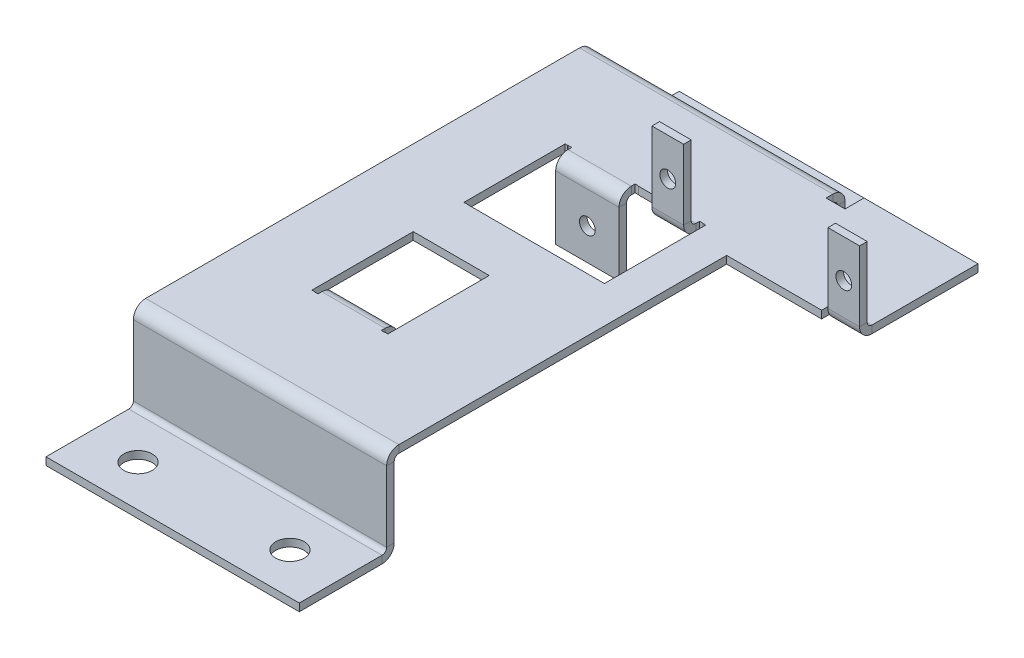
from build123d import *

# Parameters (mm, degrees)
SKETCH_1_W                       = 40
SKETCH_1_H                       = 15
SM_BASE_FLANGE_1_DEPTH           = 1.2
SM_EDGE_FLANGE_1_STRIP_W         = 6.2732
SM_EDGE_FLANGE_1_STRIP_H         = 1.2
SM_EDGE_FLANGE_1_STRIP_CUT_DEPTH = 40
SM_EDGE_FLANGE_1_DEPTH           = 40
SM_EDGE_FLANGE_2_STRIP_W         = 6.2732
SM_EDGE_FLANGE_2_STRIP_H         = 1.2
SM_EDGE_FLANGE_2_STRIP_CUT_DEPTH = 40
SM_EDGE_FLANGE_2_DEPTH           = 40
SM_EDGE_FLANGE_2_FLAT_DEPTH      = 1.2
SM_EDGE_FLANGE_3_STRIP_W         = 6.2732
SM_EDGE_FLANGE_3_STRIP_H         = 1.2
SM_EDGE_FLANGE_3_STRIP_CUT_DEPTH = 40
SM_EDGE_FLANGE_3_DEPTH           = 40
SM_EDGE_FLANGE_4_STRIP_W         = 6.2732
SM_EDGE_FLANGE_4_STRIP_H         = 1.2
SM_EDGE_FLANGE_4_STRIP_CUT_DEPTH = 40
SM_EDGE_FLANGE_4_DEPTH           = 40
CUT_EXTRUDE_1_DEPTH              = 10
SM_START                         = 13
SM_EDGE_FLANGE_5_DEPTH           = 10
SM_START_2                       = 12.4
SM_EDGE_FLANGE_5_2_OUTLINE_W     = 1.2
SM_EDGE_FLANGE_5_2_OUTLINE_H     = 0.0366
SM_EDGE_FLANGE_5_2_DEPTH         = 0.6
SM_START_3                       = 23
SM_EDGE_FLANGE_5_3_OUTLINE_W     = 1.2
SM_EDGE_FLANGE_5_3_OUTLINE_H     = 0.0366
SM_EDGE_FLANGE_5_3_DEPTH         = 0.6
SM_EDGE_FLANGE_5_4_DEPTH         = 10
SKETCH_26_R                      = 1.25
CUT_EXTRUDE_2_DEPTH              = 46
CUT_EXTRUDE_3_REACH              = 120.093
SKETCH_28_W                      = 1
SKETCH_28_H                      = 2.5
SM_START_4                       = 28.2
SM_EDGE_FLANGE_6_DEPTH           = 5
SM_START_5                       = 56
SM_EDGE_FLANGE_6_2_DEPTH         = 5
SM_START_6                       = 27.6
SM_EDGE_FLANGE_6_3_OUTLINE_W     = 1.2
SM_EDGE_FLANGE_6_3_OUTLINE_H     = 0.0366
SM_EDGE_FLANGE_6_3_DEPTH         = 0.6
SM_START_7                       = 33.2
SM_EDGE_FLANGE_6_4_OUTLINE_W     = 1.2
SM_EDGE_FLANGE_6_4_OUTLINE_H     = 0.0366
SM_EDGE_FLANGE_6_4_DEPTH         = 0.6
SM_START_8                       = 55.4
SM_EDGE_FLANGE_6_5_OUTLINE_W     = 1.2
SM_EDGE_FLANGE_6_5_OUTLINE_H     = 0.0366
SM_EDGE_FLANGE_6_5_DEPTH         = 0.6
SM_EDGE_FLANGE_6_6_DEPTH         = 5
SM_EDGE_FLANGE_6_7_DEPTH         = 5
CUT_EXTRUDE_4_REACH              = 96.512
SKETCH_35_R                      = 1.25
CUT_EXTRUDE_5_REACH              = 120.093
SKETCH_36_R                      = 2.25


# Read off the part's stored shape, not the designer's step: Ребро-кромка5, Ребро-кромка6
# Sheet-metal steps are written as plain solids
with BuildPart() as part:
    # Sketch 1 → Базовая кромка1 (new body)
    with BuildSketch(Plane(origin=(0, 0, 0), x_dir=(1, 0, 0), z_dir=(0, 1, 0))):
        with Locations((20, 7.5)):
            Rectangle(SKETCH_1_W, SKETCH_1_H)
    extrude(amount=-SM_BASE_FLANGE_1_DEPTH)

    # Ребро-кромка1 strip (across the edge) → Ребро-кромка1 strip cut (cut)
    with BuildSketch(Plane(origin=(40, 0, -15), x_dir=(0, 0, 1), z_dir=(-1, 0, 0))):
        with Locations((-1.2, -0.6)):
            Rectangle(SM_EDGE_FLANGE_1_STRIP_W, SM_EDGE_FLANGE_1_STRIP_H)
    extrude(amount=SM_EDGE_FLANGE_1_STRIP_CUT_DEPTH, mode=Mode.SUBTRACT)

    # Ребро-кромка1 section (across the edge) → Ребро-кромка1 (add)
    with BuildSketch(Plane(origin=(40, 0, -15), x_dir=(0, 0, 1), z_dir=(-1, 0, 0))):
        with BuildLine():
            Line((0, 0.7366), (0, 13.8))
            Line((0, 13.8), (1.2, 13.8))
            Line((1.2, 13.8), (1.2, 0.7366))
            ThreePointArc((1.2, 0.7366), (1.415745145, 0.215745145), (1.9366, 0))
            Line((1.9366, 0), (1.9366, -1.2))
            ThreePointArc((1.9366, -1.2), (0.567217008, -0.632782992), (0, 0.7366))
        make_face()
    extrude(amount=SM_EDGE_FLANGE_1_DEPTH)

    # Ребро-кромка2 strip (across the edge) → Ребро-кромка2 strip cut (cut)
    with BuildSketch(Plane(origin=(0, 13.8, -15), x_dir=(0, -1, 0), z_dir=(1, 0, 0))):
        with Locations((-1.2, -0.6)):
            Rectangle(SM_EDGE_FLANGE_2_STRIP_W, SM_EDGE_FLANGE_2_STRIP_H)
    extrude(amount=SM_EDGE_FLANGE_2_STRIP_CUT_DEPTH, mode=Mode.SUBTRACT)

    # Ребро-кромка2 bend section (across the edge) → Ребро-кромка2 (add)
    with BuildSketch(Plane(origin=(0, 13.8, -15), x_dir=(0, -1, 0), z_dir=(1, 0, 0))):
        with BuildLine():
            Line((0, 0.7366), (1.2, 0.7366))
            ThreePointArc((1.2, 0.7366), (1.415745145, 0.215745145), (1.9366, 0))
            Line((1.9366, 0), (1.9366, -1.2))
            ThreePointArc((1.9366, -1.2), (0.567217008, -0.632782992), (0, 0.7366))
        make_face()
    extrude(amount=SM_EDGE_FLANGE_2_DEPTH)

    # Ребро-кромка2 profile (on flange) → Ребро-кромка2 flat (add)
    with BuildSketch(Plane(origin=(0, 13.8, -15), x_dir=(1, 0, 0), z_dir=(0, 1, 0))):
        Polygon((43, 71.2), (43, 68.2), (40, 68.2), (40, 71.2), (0, 71.2), (0, 0.7366), (40, 0.7366), (40, 52.5), (61, 52.5), (61, 71.2), align=None)
    extrude(amount=-SM_EDGE_FLANGE_2_FLAT_DEPTH)

    # Ребро-кромка3 strip (across the edge) → Ребро-кромка3 strip cut (cut)
    with BuildSketch(Plane(origin=(0, 12.6, -86.2), x_dir=(0, 0, 1), z_dir=(1, 0, 0))):
        with Locations((-1.2, -0.6)):
            Rectangle(SM_EDGE_FLANGE_3_STRIP_W, SM_EDGE_FLANGE_3_STRIP_H)
    extrude(amount=SM_EDGE_FLANGE_3_STRIP_CUT_DEPTH, mode=Mode.SUBTRACT)

    # Ребро-кромка3 section (across the edge) → Ребро-кромка3 (add)
    with BuildSketch(Plane(origin=(0, 12.6, -86.2), x_dir=(0, 0, 1), z_dir=(1, 0, 0))):
        with BuildLine():
            Line((0, 0.7366), (0, 13.8))
            Line((0, 13.8), (1.2, 13.8))
            Line((1.2, 13.8), (1.2, 0.7366))
            ThreePointArc((1.2, 0.7366), (1.415745145, 0.215745145), (1.9366, 0))
            Line((1.9366, 0), (1.9366, -1.2))
            ThreePointArc((1.9366, -1.2), (0.567217008, -0.632782992), (0, 0.7366))
        make_face()
    extrude(amount=SM_EDGE_FLANGE_3_DEPTH)

    # Ребро-кромка4 strip (across the edge) → Ребро-кромка4 strip cut (cut)
    with BuildSketch(Plane(origin=(40, -1.2, -86.2), x_dir=(0, 1, 0), z_dir=(-1, 0, 0))):
        with Locations((-1.2, -0.6)):
            Rectangle(SM_EDGE_FLANGE_4_STRIP_W, SM_EDGE_FLANGE_4_STRIP_H)
    extrude(amount=SM_EDGE_FLANGE_4_STRIP_CUT_DEPTH, mode=Mode.SUBTRACT)

    # Ребро-кромка4 section (across the edge) → Ребро-кромка4 (add)
    with BuildSketch(Plane(origin=(40, -1.2, -86.2), x_dir=(0, 1, 0), z_dir=(-1, 0, 0))):
        with BuildLine():
            Line((0, 0.7366), (0, 13.8))
            Line((0, 13.8), (1.2, 13.8))
            Line((1.2, 13.8), (1.2, 0.7366))
            ThreePointArc((1.2, 0.7366), (1.415745145, 0.215745145), (1.9366, 0))
            Line((1.9366, 0), (1.9366, -1.2))
            ThreePointArc((1.9366, -1.2), (0.567217008, -0.632782992), (0, 0.7366))
        make_face()
    extrude(amount=SM_EDGE_FLANGE_4_DEPTH)

    # Эскиз19 → Вырез-Вытянуть1 (cut)
    with BuildSketch(Plane(origin=(0, 13.8, 0), x_dir=(1, 0, 0), z_dir=(0, 1, 0))):
        Polygon((13, 32.5), (23, 32.5), (23, 30), (24, 30), (24, 46), (12, 46), (12, 30), (13, 30), align=None)
        Polygon((12, 54), (24, 54), (24, 70), (23, 70), (23, 67.5), (13, 67.5), (13, 70), (12, 70), align=None)
    extrude(amount=-CUT_EXTRUDE_1_DEPTH, mode=Mode.SUBTRACT)

    # Ребро-кромка5 outline → Ребро-кромка5 (cut)
    with BuildSketch(Plane.YZ.offset(SM_START)):
        with BuildLine():
            Line((12.6, -67.5), (12.6, -67.645555612))
            ThreePointArc((12.6, -67.645555612), (13.472269031, -68.358657516), (13.8, -69.4366))
            Line((13.8, -69.4366), (13.8, -67.5))
            Line((13.8, -67.5), (12.6, -67.5))
        make_face()
        with BuildLine():
            Line((12.6, -32.354444388), (12.6, -32.5))
            Line((12.6, -32.5), (13.8, -32.5))
            Line((13.8, -32.5), (13.8, -30.5634))
            ThreePointArc((13.8, -30.5634), (13.472269031, -31.641342484), (12.6, -32.354444388))
        make_face()
    extrude(amount=SM_EDGE_FLANGE_5_DEPTH, mode=Mode.SUBTRACT)

    # Sm Edge Flange 5 2 outline → Sm Edge Flange 5 2 (cut)
    with BuildSketch(Plane.YZ.offset(SM_START_2)):
        with Locations((13.2, -70.0183)):
            Rectangle(SM_EDGE_FLANGE_5_2_OUTLINE_W, SM_EDGE_FLANGE_5_2_OUTLINE_H)
        with Locations((13.2, -29.9817)):
            Rectangle(SM_EDGE_FLANGE_5_2_OUTLINE_W, SM_EDGE_FLANGE_5_2_OUTLINE_H)
    extrude(amount=SM_EDGE_FLANGE_5_2_DEPTH, mode=Mode.SUBTRACT)

    # Sm Edge Flange 5 3 outline → Sm Edge Flange 5 3 (cut)
    with BuildSketch(Plane.YZ.offset(SM_START_3)):
        with Locations((13.2, -70.0183)):
            Rectangle(SM_EDGE_FLANGE_5_3_OUTLINE_W, SM_EDGE_FLANGE_5_3_OUTLINE_H)
        with Locations((13.2, -29.9817)):
            Rectangle(SM_EDGE_FLANGE_5_3_OUTLINE_W, SM_EDGE_FLANGE_5_3_OUTLINE_H)
    extrude(amount=SM_EDGE_FLANGE_5_3_DEPTH, mode=Mode.SUBTRACT)

    # Sm Edge Flange 5 4 outline → Sm Edge Flange 5 4 (add)
    with BuildSketch(Plane.YZ.offset(SM_START)):
        with BuildLine():
            Line((11.8634, -67.5), (1.8, -67.5))
            Line((1.8, -67.5), (1.8, -68.7))
            Line((1.8, -68.7), (11.8634, -68.7))
            ThreePointArc((11.8634, -68.7), (12.384254855, -68.915745145), (12.6, -69.4366))
            Line((12.6, -69.4366), (12.6, -67.645555612))
            ThreePointArc((12.6, -67.645555612), (12.238821762, -67.536737358), (11.8634, -67.5))
        make_face()
        with BuildLine():
            ThreePointArc((11.8634, -32.5), (12.238821762, -32.463262642), (12.6, -32.354444388))
            Line((12.6, -32.354444388), (12.6, -30.5634))
            ThreePointArc((12.6, -30.5634), (12.384254855, -31.084254855), (11.8634, -31.3))
            Line((11.8634, -31.3), (1.8, -31.3))
            Line((1.8, -31.3), (1.8, -32.5))
            Line((1.8, -32.5), (11.8634, -32.5))
        make_face()
    extrude(amount=SM_EDGE_FLANGE_5_4_DEPTH)

    # Эскиз26 → Вырез-Вытянуть2 (cut)
    with BuildSketch(Plane.XY.offset(-31.3)):
        with Locations((18, 6.8317)):
            Circle(SKETCH_26_R)
    extrude(amount=-CUT_EXTRUDE_2_DEPTH, mode=Mode.SUBTRACT)

    # Эскиз28 → Вырез-Вытянуть3 (cut, up to next)
    with BuildSketch(Plane(origin=(0, 13.8, 0), x_dir=(1, 0, 0), z_dir=(0, 1, 0)), mode=Mode.PRIVATE) as cut_extrude_3_sk1:
        with Locations((55.5, 68.75)):
            Rectangle(SKETCH_28_W, SKETCH_28_H)
    cut_extrude_3_tool1 = extrude(cut_extrude_3_sk1.sketch, amount=-CUT_EXTRUDE_3_REACH, mode=Mode.PRIVATE) & part.part
    # Эскиз28 → Вырез-Вытянуть3 (cut, up to next)
    with BuildSketch(Plane(origin=(0, 13.8, 0), x_dir=(1, 0, 0), z_dir=(0, 1, 0)), mode=Mode.PRIVATE) as cut_extrude_3_sk2:
        Polygon((28.2, 67.5), (33.2, 67.5), (33.2, 70), (34.2, 70), (34.2, 54), (23, 54), (23, 70), (28.2, 70), align=None)
    cut_extrude_3_tool2 = extrude(cut_extrude_3_sk2.sketch, amount=-CUT_EXTRUDE_3_REACH, mode=Mode.PRIVATE) & part.part
    add(cut_extrude_3_tool1.solids().sort_by_distance((55.5, 13.8, -68.75))[0], mode=Mode.SUBTRACT)
    add(cut_extrude_3_tool2.solids().sort_by_distance((28.442531, 13.8, -61.493851))[0], mode=Mode.SUBTRACT)

    # Ребро-кромка6 outline → Ребро-кромка6 (cut)
    with BuildSketch(Plane.YZ.offset(SM_START_4)):
        with BuildLine():
            ThreePointArc((12.6, -69.4366), (12.927730969, -68.358657516), (13.8, -67.645555612))
            Line((13.8, -67.645555612), (13.8, -67.5))
            Line((13.8, -67.5), (12.6, -67.5))
            Line((12.6, -67.5), (12.6, -69.4366))
        make_face()
    extrude(amount=SM_EDGE_FLANGE_6_DEPTH, mode=Mode.SUBTRACT)

    # Sm Edge Flange 6 2 outline → Sm Edge Flange 6 2 (cut)
    with BuildSketch(Plane.YZ.offset(SM_START_5)):
        with BuildLine():
            ThreePointArc((12.6, -69.4366), (12.927730969, -68.358657516), (13.8, -67.645555612))
            Line((13.8, -67.645555612), (13.8, -67.5))
            Line((13.8, -67.5), (12.6, -67.5))
            Line((12.6, -67.5), (12.6, -69.4366))
        make_face()
    extrude(amount=SM_EDGE_FLANGE_6_2_DEPTH, mode=Mode.SUBTRACT)

    # Sm Edge Flange 6 3 outline → Sm Edge Flange 6 3 (cut)
    with BuildSketch(Plane.YZ.offset(SM_START_6)):
        with Locations((13.2, -70.0183)):
            Rectangle(SM_EDGE_FLANGE_6_3_OUTLINE_W, SM_EDGE_FLANGE_6_3_OUTLINE_H)
    extrude(amount=SM_EDGE_FLANGE_6_3_DEPTH, mode=Mode.SUBTRACT)

    # Sm Edge Flange 6 4 outline → Sm Edge Flange 6 4 (cut)
    with BuildSketch(Plane.YZ.offset(SM_START_7)):
        with Locations((13.2, -70.0183)):
            Rectangle(SM_EDGE_FLANGE_6_4_OUTLINE_W, SM_EDGE_FLANGE_6_4_OUTLINE_H)
    extrude(amount=SM_EDGE_FLANGE_6_4_DEPTH, mode=Mode.SUBTRACT)

    # Sm Edge Flange 6 5 outline → Sm Edge Flange 6 5 (cut)
    with BuildSketch(Plane.YZ.offset(SM_START_8)):
        with Locations((13.2, -70.0183)):
            Rectangle(SM_EDGE_FLANGE_6_5_OUTLINE_W, SM_EDGE_FLANGE_6_5_OUTLINE_H)
    extrude(amount=SM_EDGE_FLANGE_6_5_DEPTH, mode=Mode.SUBTRACT)

    # Sm Edge Flange 6 6 outline → Sm Edge Flange 6 6 (add)
    with BuildSketch(Plane.YZ.offset(SM_START_4)):
        with BuildLine():
            Line((25.6, -67.5), (14.5366, -67.5))
            ThreePointArc((14.5366, -67.5), (14.161178238, -67.536737358), (13.8, -67.645555612))
            Line((13.8, -67.645555612), (13.8, -69.4366))
            ThreePointArc((13.8, -69.4366), (14.015745145, -68.915745145), (14.5366, -68.7))
            Line((14.5366, -68.7), (25.6, -68.7))
            Line((25.6, -68.7), (25.6, -67.5))
        make_face()
    extrude(amount=SM_EDGE_FLANGE_6_6_DEPTH)

    # Sm Edge Flange 6 7 outline → Sm Edge Flange 6 7 (add)
    with BuildSketch(Plane.YZ.offset(SM_START_5)):
        with BuildLine():
            Line((25.6, -67.5), (14.5366, -67.5))
            ThreePointArc((14.5366, -67.5), (14.161178238, -67.536737358), (13.8, -67.645555612))
            Line((13.8, -67.645555612), (13.8, -69.4366))
            ThreePointArc((13.8, -69.4366), (14.015745145, -68.915745145), (14.5366, -68.7))
            Line((14.5366, -68.7), (25.6, -68.7))
            Line((25.6, -68.7), (25.6, -67.5))
        make_face()
    extrude(amount=SM_EDGE_FLANGE_6_7_DEPTH)

    # Эскиз35 → Вырез-Вытянуть4 (cut, up to next)
    with BuildSketch(Plane.XY.offset(-67.5), mode=Mode.PRIVATE) as cut_extrude_4_sk1:
        with Locations((30.7, 19.6)):
            Circle(SKETCH_35_R)
    cut_extrude_4_tool1 = extrude(cut_extrude_4_sk1.sketch, amount=-CUT_EXTRUDE_4_REACH, mode=Mode.PRIVATE) & part.part
    # Эскиз35 → Вырез-Вытянуть4 (cut, up to next)
    with BuildSketch(Plane.XY.offset(-67.5), mode=Mode.PRIVATE) as cut_extrude_4_sk2:
        with Locations((58.5, 19.6)):
            Circle(SKETCH_35_R)
    cut_extrude_4_tool2 = extrude(cut_extrude_4_sk2.sketch, amount=-CUT_EXTRUDE_4_REACH, mode=Mode.PRIVATE) & part.part
    add(cut_extrude_4_tool1.solids().sort_by_distance((30.7, 19.6, -67.5))[0], mode=Mode.SUBTRACT)
    add(cut_extrude_4_tool2.solids().sort_by_distance((58.5, 19.6, -67.5))[0], mode=Mode.SUBTRACT)

    # Эскиз36 → Вырез-Вытянуть5 (cut, up to next)
    with BuildSketch(Plane(origin=(0, 13.8, 0), x_dir=(1, 0, 0), z_dir=(0, 1, 0)), mode=Mode.PRIVATE) as cut_extrude_5_sk1:
        with Locations(Location((8, 93.4683, 0), (0, 0, 270))):
            Circle(SKETCH_36_R)
    cut_extrude_5_tool1 = extrude(cut_extrude_5_sk1.sketch, amount=-CUT_EXTRUDE_5_REACH, mode=Mode.PRIVATE) & part.part
    # Эскиз36 → Вырез-Вытянуть5 (cut, up to next)
    with BuildSketch(Plane(origin=(0, 13.8, 0), x_dir=(1, 0, 0), z_dir=(0, 1, 0)), mode=Mode.PRIVATE) as cut_extrude_5_sk2:
        with Locations(Location((32, 93.4683, 0), (0, 0, 270))):
            Circle(SKETCH_36_R)
    cut_extrude_5_tool2 = extrude(cut_extrude_5_sk2.sketch, amount=-CUT_EXTRUDE_5_REACH, mode=Mode.PRIVATE) & part.part
    # Эскиз36 → Вырез-Вытянуть5 (cut, up to next)
    with BuildSketch(Plane(origin=(0, 13.8, 0), x_dir=(1, 0, 0), z_dir=(0, 1, 0)), mode=Mode.PRIVATE) as cut_extrude_5_sk3:
        with Locations(Location((8, 6.5317, 0), (0, 0, 90))):
            Circle(SKETCH_36_R)
    cut_extrude_5_tool3 = extrude(cut_extrude_5_sk3.sketch, amount=-CUT_EXTRUDE_5_REACH, mode=Mode.PRIVATE) & part.part
    # Эскиз36 → Вырез-Вытянуть5 (cut, up to next)
    with BuildSketch(Plane(origin=(0, 13.8, 0), x_dir=(1, 0, 0), z_dir=(0, 1, 0)), mode=Mode.PRIVATE) as cut_extrude_5_sk4:
        with Locations(Location((32, 6.5317, 0), (0, 0, 90))):
            Circle(SKETCH_36_R)
    cut_extrude_5_tool4 = extrude(cut_extrude_5_sk4.sketch, amount=-CUT_EXTRUDE_5_REACH, mode=Mode.PRIVATE) & part.part
    add(cut_extrude_5_tool1.solids().sort_by_distance((8, 13.8, -93.4683))[0], mode=Mode.SUBTRACT)
    add(cut_extrude_5_tool2.solids().sort_by_distance((32, 13.8, -93.4683))[0], mode=Mode.SUBTRACT)
    add(cut_extrude_5_tool3.solids().sort_by_distance((8, 13.8, -6.5317))[0], mode=Mode.SUBTRACT)
    add(cut_extrude_5_tool4.solids().sort_by_distance((32, 13.8, -6.5317))[0], mode=Mode.SUBTRACT)


solid = part.part
